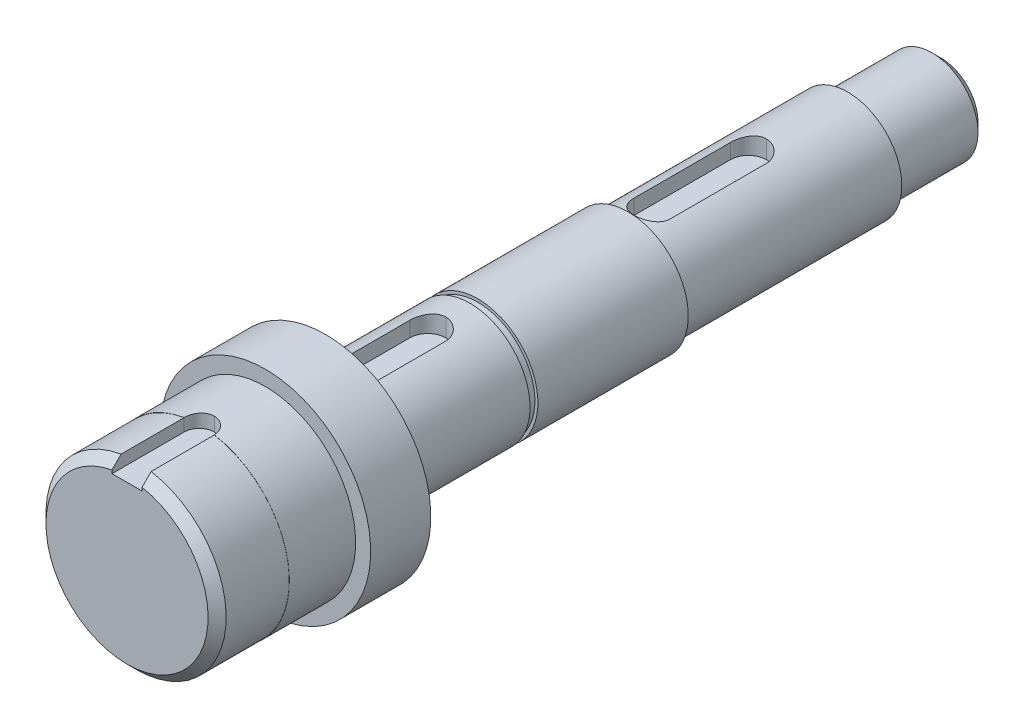
from build123d import *

# Parameters (mm, degrees)
SKETCH1_R          = 14.975
EXTRUDE1_DEPTH     = 12
SKETCH2_R          = 15
EXTRUDE2_DEPTH     = 11
SKETCH3_R          = 17.5
EXTRUDE3_DEPTH     = 10
SKETCH4_R          = 10
EXTRUDE4_DEPTH     = 24
SKETCH5_R          = 9.5
EXTRUDE5_DEPTH     = 1.3
SKETCH6_R          = 10
EXTRUDE6_DEPTH     = 25
SKETCH7_R          = 9
EXTRUDE7_DEPTH     = 36.5
SKETCH8_R          = 7.660195653
EXTRUDE8_DEPTH     = 15.5
SKETCH9_W          = 5
SKETCH9_H          = 5.185185185
CUT_EXTRUDE1_DEPTH = 14.5
FILLET1_R          = 2.5
CHAMFER1_SIZE      = 1.5
SKETCH10_W         = 6
SKETCH10_H         = 18
CUT_EXTRUDE2_DEPTH = 3
FILLET2_R          = 3
CUT_EXTRUDE3_DEPTH = 3
FILLET3_R          = 3
CHAMFER2_SIZE      = 1.5


with BuildPart() as part:
    # Sketch1 → Extrude1 (new body)
    with BuildSketch(Plane.XY):
        Circle(SKETCH1_R)
    extrude(amount=-EXTRUDE1_DEPTH)

    # Sketch2 → Extrude2 (add)
    with BuildSketch(Plane(origin=(0, 0, -12), x_dir=(-1, 0, 0), z_dir=(0, 0, -1))):
        Circle(SKETCH2_R)
    extrude(amount=EXTRUDE2_DEPTH)

    # Sketch3 → Extrude3 (add)
    with BuildSketch(Plane(origin=(0, 0, -23), x_dir=(-1, 0, 0), z_dir=(0, 0, -1))):
        Circle(SKETCH3_R)
    extrude(amount=EXTRUDE3_DEPTH)

    # Sketch4 → Extrude4 (add)
    with BuildSketch(Plane(origin=(0, 0, -33), x_dir=(-1, 0, 0), z_dir=(0, 0, -1))):
        Circle(SKETCH4_R)
    extrude(amount=EXTRUDE4_DEPTH)

    # Sketch5 → Extrude5 (add)
    with BuildSketch(Plane(origin=(0, 0, -57), x_dir=(-1, 0, 0), z_dir=(0, 0, -1))):
        Circle(SKETCH5_R)
    extrude(amount=EXTRUDE5_DEPTH)

    # Sketch6 → Extrude6 (add)
    with BuildSketch(Plane(origin=(0, 0, -58.3), x_dir=(-1, 0, 0), z_dir=(0, 0, -1))):
        Circle(SKETCH6_R)
    extrude(amount=EXTRUDE6_DEPTH)

    # Sketch7 → Extrude7 (add)
    with BuildSketch(Plane(origin=(0, 0, -83.3), x_dir=(-1, 0, 0), z_dir=(0, 0, -1))):
        Circle(SKETCH7_R)
    extrude(amount=EXTRUDE7_DEPTH)

    # Sketch8 → Extrude8 (add)
    with BuildSketch(Plane(origin=(0, 0, -119.8), x_dir=(-1, 0, 0), z_dir=(0, 0, -1))):
        Circle(SKETCH8_R)
    extrude(amount=EXTRUDE8_DEPTH)

    # Sketch9 → Cut-Extrude1 (cut)
    with BuildSketch(Plane.XY):
        with Locations((0, 15.292592593)):
            Rectangle(SKETCH9_W, SKETCH9_H)
    extrude(amount=-CUT_EXTRUDE1_DEPTH, mode=Mode.SUBTRACT)

    # Fillet1
    fillet1_edges = [part.edges().sort_by_distance(p)[0] for p in [
        (2.5, 13.745099729, -14.5),
        (-2.5, 13.745099729, -14.5),
    ]]
    fillet(fillet1_edges, radius=FILLET1_R - 0.0001)  # a hair under: the kernel refuses the full size

    # Chamfer1
    chamfer1_edges = [part.edges().sort_by_distance(p)[0] for p in [
        (0, -14.975, 0),
    ]]
    chamfer(chamfer1_edges, length=CHAMFER1_SIZE)

    # Sketch10 → Cut-Extrude2 (cut)
    with BuildSketch(Plane(origin=(0, 10, 0), x_dir=(-1, 0, 0), z_dir=(0, 1, 0))):
        with Locations((0, -44)):
            Rectangle(SKETCH10_W, SKETCH10_H)
    extrude(amount=-CUT_EXTRUDE2_DEPTH, mode=Mode.SUBTRACT)

    # Fillet2
    fillet2_edges = [part.edges().sort_by_distance(p)[0] for p in [
        (3, 8.269696007, -53),
        (-3, 8.269696007, -53),
        (-3, 8.269696007, -35),
        (3, 8.269696007, -35),
    ]]
    fillet(fillet2_edges, radius=FILLET2_R - 0.0001)  # a hair under: the kernel refuses the full size

    # Sketch11 → Cut-Extrude3 (cut)
    with BuildSketch(Plane(origin=(0, 9, 0), x_dir=(-1, 0, 0), z_dir=(0, 1, 0))):
        Polygon((-3.005512872, -84.3), (2.996762617, -84.3), (2.994487128, -106.299999882), (-3.005512872, -106.3), align=None)
    extrude(amount=-CUT_EXTRUDE3_DEPTH, mode=Mode.SUBTRACT)

    # Fillet3
    fillet3_edges = [part.edges().sort_by_distance(p)[0] for p in [
        (-2.994487128, 7.243614227, -106.299999882),
        (3.005512872, 7.241665132, -106.3),
        (3.005512872, 7.241665132, -84.3),
        (-2.996762617, 7.243212634, -84.3),
    ]]
    fillet(fillet3_edges, radius=FILLET3_R)

    # Chamfer2
    chamfer2_edges = [part.edges().sort_by_distance(p)[0] for p in [
        (7.660195653, 0, -135.3),
    ]]
    chamfer(chamfer2_edges, length=CHAMFER2_SIZE)


solid = part.part
